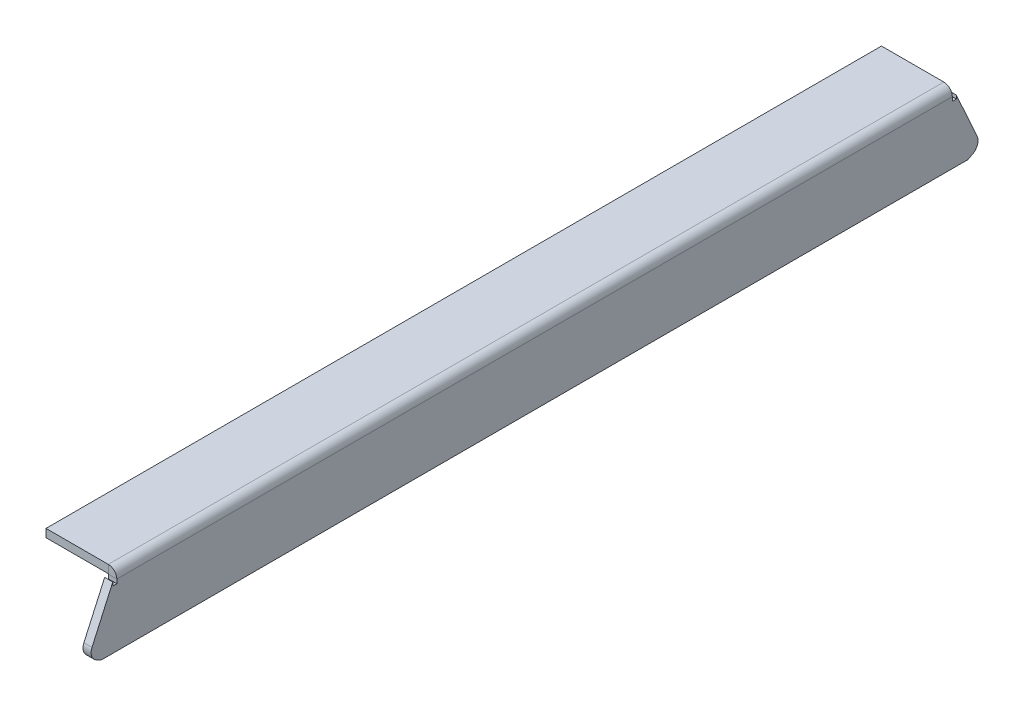
from build123d import *

# Parameters (mm, degrees)
BASE_FLANGE1_DEPTH            = 4
EDGE_FLANGE1_STRIP_W          = 16.4
EDGE_FLANGE1_STRIP_H          = 4
EDGE_FLANGE1_STRIP_CUT_DEPTH  = 412.942027617
EDGE_FLANGE1_RELIEF_W         = 18.4
EDGE_FLANGE1_RELIEF_H         = 2
EDGE_FLANGE1_RELIEF_CUT_DEPTH = 4
EDGE_FLANGE1_DEPTH            = 412.942027617


# Sheet-metal steps are written as plain solids
with BuildPart() as part:
    # Sketch1 → Base-Flange1 (new body)
    with BuildSketch(Plane(origin=(0, 0, 0), x_dir=(0, 0, -1), z_dir=(1, 0, 0))):
        with BuildLine():
            Line((188.350009653, 33.355878637), (-224.592017965, 33.355878637))
            Line((-224.592017965, 33.355878637), (-236.864654255, 6.041062278))
            ThreePointArc((-236.864654255, 6.041062278), (-237.017988994, 2.32545676), (-234.563610744, -0.468333375))
            Line((-234.563610744, -0.468333375), (-232.242884183, -1.644121363))
            Line((-232.242884183, -1.644121363), (196.000875871, -1.644121363))
            Line((196.000875871, -1.644121363), (198.321602432, -0.468333375))
            ThreePointArc((198.321602432, -0.468333375), (200.775980682, 2.32545676), (200.622645942, 6.041062278))
            Line((200.622645942, 6.041062278), (188.350009653, 33.355878637))
        make_face()
    extrude(amount=-BASE_FLANGE1_DEPTH)

    # Edge-Flange1 strip (across the edge) → Edge-Flange1 strip cut (cut)
    with BuildSketch(Plane(origin=(-4, 33.355878637, 224.592017965), x_dir=(0, -1, 0), z_dir=(0, 0, -1))):
        with Locations((-4, -2)):
            Rectangle(EDGE_FLANGE1_STRIP_W, EDGE_FLANGE1_STRIP_H)
    extrude(amount=EDGE_FLANGE1_STRIP_CUT_DEPTH, mode=Mode.SUBTRACT)

    # Edge-Flange1 relief (on the sheet) → Edge-Flange1 relief cut (cut)
    with BuildSketch(Plane(origin=(-4, 29.155878637, 224.592017965), x_dir=(0, -1, 0), z_dir=(-1, 0, 0))):
        with Locations((-7.2, 1)):
            Rectangle(EDGE_FLANGE1_RELIEF_W, EDGE_FLANGE1_RELIEF_H)
        with Locations((-7.2, -413.942027617)):
            Rectangle(EDGE_FLANGE1_RELIEF_W, EDGE_FLANGE1_RELIEF_H)
    extrude(amount=-EDGE_FLANGE1_RELIEF_CUT_DEPTH, mode=Mode.SUBTRACT)

    # Edge-Flange1 section (across the edge) → Edge-Flange1 (add)
    with BuildSketch(Plane(origin=(-4, 33.355878637, 224.592017965), x_dir=(0, -1, 0), z_dir=(0, 0, -1))):
        with BuildLine():
            Line((0, 0.2), (0, 31))
            Line((0, 31), (4, 31))
            Line((4, 31), (4, 0.2))
            ThreePointArc((4, 0.2), (4.058578644, 0.058578644), (4.2, 0))
            Line((4.2, 0), (4.2, -4))
            ThreePointArc((4.2, -4), (1.230151519, -2.769848481), (0, 0.2))
        make_face()
    extrude(amount=EDGE_FLANGE1_DEPTH)


solid = part.part
